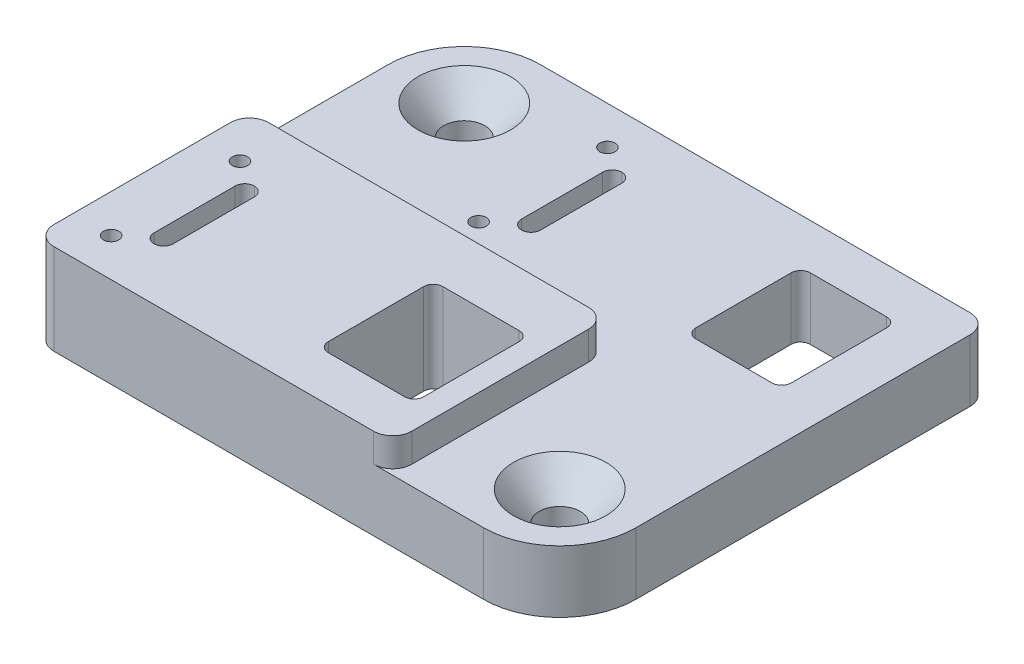
from build123d import *

# Parameters (mm, degrees)
BASE_SKETCH_W                       = 55
BASE_SKETCH_H                       = 45
BASE_EXTRUDE_DEPTH                  = 6.5
RAISED_SECTION_SKETCH_W             = 37.5
RAISED_SECTION_SKETCH_H             = 22.5
RAISED_SECTION_EXTRUDE_DEPTH        = 3
MOSFET_MOUNTING_HOLES_D             = 1.6
MOUNTING_HOLES_D                    = 4.3053
MOUNTING_HOLES_CSINK_D              = 9.6944688
MOUNTING_HOLES_CSINK_ANGLE          = 82
CUT_PIN_RELIEF_DEPTH                = 54.136616377
CUT_PIN_RELIEF_DEPTH_BACK           = 54.136616377
PIN_SKETCH_W                        = 10
PIN_SKETCH_H                        = 12
PIN_SKETCH_W_2                      = 2
PIN_SKETCH_H_2                      = 10.5
LARGE_OUTSIDE_CORNER_FILLETS_R      = 8
SMALL_OUTSIDE_CORNER_FILLETS_R      = 2
SCREW_TERMINAL_CUTOUT_FILLETS_R     = 1
HEADER_PINS_CUTOUT_RELIEF_FILLETS_R = 1


with BuildPart() as part:
    # Base Sketch → Base Extrude (new body)
    with BuildSketch(Plane(origin=(0, 0, 0), x_dir=(1, 0, 0), z_dir=(0, 1, 0))):
        with Locations((0, 22.5)):
            Rectangle(BASE_SKETCH_W, BASE_SKETCH_H)
    extrude(amount=-BASE_EXTRUDE_DEPTH)

    # Raised Section Sketch → Raised Section Extrude (add)
    with BuildSketch(Plane(origin=(0, 0, 0), x_dir=(1, 0, 0), z_dir=(0, 1, 0))):
        with Locations((-8.75, 11.25)):
            Rectangle(RAISED_SECTION_SKETCH_W, RAISED_SECTION_SKETCH_H)
    extrude(amount=RAISED_SECTION_EXTRUDE_DEPTH)

    # Mosfet Mounting Holes (through all)
    with Locations(Plane(origin=(0, 3, 0), x_dir=(1, 0, 0), z_dir=(0, 1, 0))):
        with Locations((-23.5, 4), (-23.5, 17.5), (-8.5, 27.5), (-8.5, 41)):
            Hole(MOSFET_MOUNTING_HOLES_D / 2)

    # Mounting Holes (through all)
    with Locations(Plane(origin=(0, 0, 0), x_dir=(1, 0, 0), z_dir=(0, 1, 0))):
        with Locations((-20, 37.5), (20, 7.5)):
            CounterSinkHole(MOUNTING_HOLES_D / 2, MOUNTING_HOLES_CSINK_D / 2, counter_sink_angle=MOUNTING_HOLES_CSINK_ANGLE)

    # Pin Sketch → Cut Pin Relief (cut, two sides: drawn at the far end of the back side and taken through both)
    with BuildSketch(Plane(origin=(0, 0, 0), x_dir=(1, 0, 0), z_dir=(0, 1, 0)).offset(-CUT_PIN_RELIEF_DEPTH_BACK)):
        with Locations((2.5, 10.75)):
            Rectangle(PIN_SKETCH_W, PIN_SKETCH_H)
        with Locations((17.5, 34.25)):
            Rectangle(PIN_SKETCH_W, PIN_SKETCH_H)
        with Locations((-20.5, 10.75)):
            Rectangle(PIN_SKETCH_W_2, PIN_SKETCH_H_2)
        with Locations((-5.5, 34.25)):
            Rectangle(PIN_SKETCH_W_2, PIN_SKETCH_H_2)
    extrude(amount=CUT_PIN_RELIEF_DEPTH + CUT_PIN_RELIEF_DEPTH_BACK, mode=Mode.SUBTRACT)

    # Large Outside Corner Fillets
    large_outside_corner_fillets_edges = [part.edges().sort_by_distance(p)[0] for p in [
        (-27.5, -3.25, -45),
        (27.5, -3.25, 0),
    ]]
    fillet(large_outside_corner_fillets_edges, radius=LARGE_OUTSIDE_CORNER_FILLETS_R)

    # Small Outside Corner Fillets
    small_outside_corner_fillets_edges = [part.edges().sort_by_distance(p)[0] for p in [
        (-27.5, 1.5, -22.5),
        (10, 1.5, 0),
        (10, 1.5, -22.5),
        (27.5, -3.25, -45),
        (-27.5, -1.75, 0),
    ]]
    fillet(small_outside_corner_fillets_edges, radius=SMALL_OUTSIDE_CORNER_FILLETS_R)

    # Screw Terminal Cutout Fillets
    screw_terminal_cutout_fillets_edges = [part.edges().sort_by_distance(p)[0] for p in [
        (-2.5, -1.75, -4.75),
        (-2.5, -1.75, -16.75),
        (7.5, -1.75, -16.75),
        (7.5, -1.75, -4.75),
        (12.5, -3.25, -28.25),
        (12.5, -3.25, -40.25),
        (22.5, -3.25, -40.25),
        (22.5, -3.25, -28.25),
    ]]
    fillet(screw_terminal_cutout_fillets_edges, radius=SCREW_TERMINAL_CUTOUT_FILLETS_R)

    # Header Pins Cutout Relief Fillets
    header_pins_cutout_relief_fillets_edges = [part.edges().sort_by_distance(p)[0] for p in [
        (-4.5, -3.25, -29),
        (-6.5, -3.25, -29),
        (-6.5, -3.25, -39.5),
        (-4.5, -3.25, -39.5),
        (-19.5, -1.75, -16),
        (-21.5, -1.75, -16),
        (-21.5, -1.75, -5.5),
        (-19.5, -1.75, -5.5),
    ]]
    fillet(header_pins_cutout_relief_fillets_edges, radius=HEADER_PINS_CUTOUT_RELIEF_FILLETS_R - 0.0001)  # a hair under: the kernel refuses the full size


solid = part.part
